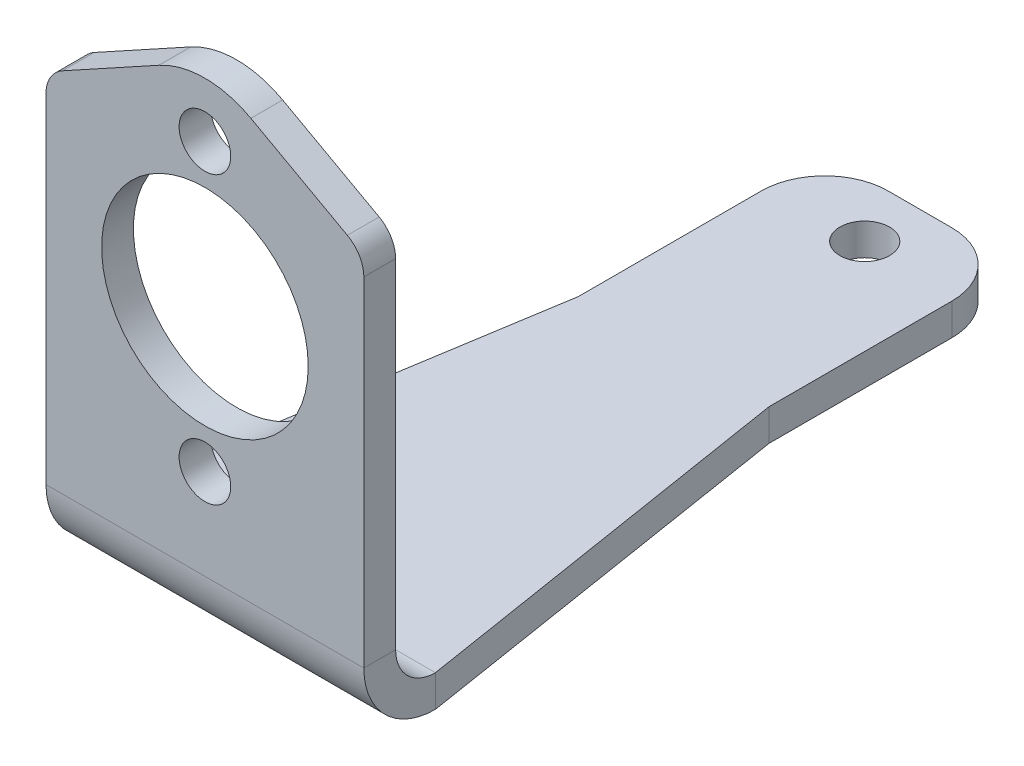
from build123d import *

# Parameters (mm, degrees)
SKETCH1_R                    = 20.6375
SKETCH1_R_2                  = 5.159375
BASE_FLANGE1_DEPTH           = 6.35
EDGE_FLANGE1_STRIP_W         = 41.3004
EDGE_FLANGE1_STRIP_H         = 6.35
EDGE_FLANGE1_STRIP_CUT_DEPTH = 63.5
EDGE_FLANGE1_DEPTH           = 63.5
SKETCH9_R                    = 4.9609375
CUT_EXTRUDE1_DEPTH           = 184.910350528
CUT_EXTRUDE2_DEPTH           = 188.331726574
FILLET1_R                    = 19.05
FILLET2_R                    = 6.35
FILLET3_R                    = 12.7


# Sheet-metal steps are written as plain solids
with BuildPart() as part:
    # Sketch1 → Base-Flange1 (new body)
    with BuildSketch(Plane.XY):
        Polygon((0, 85.725), (31.75, 103.1875), (63.5, 85.725), (63.5, 0), (0, 0), align=None)
        with Locations((31.75, 60.96)):
            Circle(SKETCH1_R, mode=Mode.SUBTRACT)
        with Locations((31.75, 89.535)):
            Circle(SKETCH1_R_2, mode=Mode.SUBTRACT)
        with Locations((31.75, 32.385)):
            Circle(SKETCH1_R_2, mode=Mode.SUBTRACT)
    extrude(amount=-BASE_FLANGE1_DEPTH)

    # Edge-Flange1 strip (across the edge) → Edge-Flange1 strip cut (cut)
    with BuildSketch(Plane(origin=(63.5, 0, -6.35), x_dir=(0, 1, 0), z_dir=(-1, 0, 0))):
        with Locations((-6.35, -3.175)):
            Rectangle(EDGE_FLANGE1_STRIP_W, EDGE_FLANGE1_STRIP_H)
    extrude(amount=EDGE_FLANGE1_STRIP_CUT_DEPTH, mode=Mode.SUBTRACT)

    # Edge-Flange1 section (across the edge) → Edge-Flange1 (add)
    with BuildSketch(Plane(origin=(63.5, 0, -6.35), x_dir=(0, 1, 0), z_dir=(-1, 0, 0))):
        with BuildLine():
            Line((0, 7.9502), (0, 136.525))
            Line((0, 136.525), (6.35, 136.525))
            Line((6.35, 136.525), (6.35, 7.9502))
            ThreePointArc((6.35, 7.9502), (8.678559668, 2.328559668), (14.3002, 0))
            Line((14.3002, 0), (14.3002, -6.35))
            ThreePointArc((14.3002, -6.35), (4.188431608, -2.161568392), (0, 7.9502))
        make_face()
    extrude(amount=EDGE_FLANGE1_DEPTH)

    # Sketch9 → Cut-Extrude1 (cut, through all)
    with BuildSketch(Plane(origin=(0, 6.35, 0), x_dir=(1, 0, 0), z_dir=(0, 1, 0))):
        with Locations(Location((31.75, 30.226, 0), (0, 0, 270))):
            Circle(SKETCH9_R)
        with Locations(Location((31.75, 131.826, 0), (0, 0, 270))):
            Circle(SKETCH9_R)
    extrude(amount=-CUT_EXTRUDE1_DEPTH, mode=Mode.SUBTRACT)

    # Sketch10 → Cut-Extrude2 (cut, through all)
    with BuildSketch(Plane.XZ):
        Polygon((0, -142.875), (12.7, -142.875), (12.7, -93.6752), (0, -14.3002), align=None)
        Polygon((63.5, -142.875), (63.5, -14.3002), (50.8, -93.6752), (50.8, -142.875), align=None)
    extrude(amount=-CUT_EXTRUDE2_DEPTH, mode=Mode.SUBTRACT)

    # Fillet1
    fillet1_edges = [part.edges().sort_by_distance(p)[0] for p in [
        (31.75, 103.1875, -3.175),
    ]]
    fillet(fillet1_edges, radius=FILLET1_R)

    # Fillet2
    fillet2_edges = [part.edges().sort_by_distance(p)[0] for p in [
        (0, 85.725, -3.175),
        (63.5, 85.725, -3.175),
    ]]
    fillet(fillet2_edges, radius=FILLET2_R)

    # Fillet3
    fillet3_edges = [part.edges().sort_by_distance(p)[0] for p in [
        (50.8, 3.175, -142.875),
        (12.7, 3.175, -142.875),
    ]]
    fillet(fillet3_edges, radius=FILLET3_R)


solid = part.part
